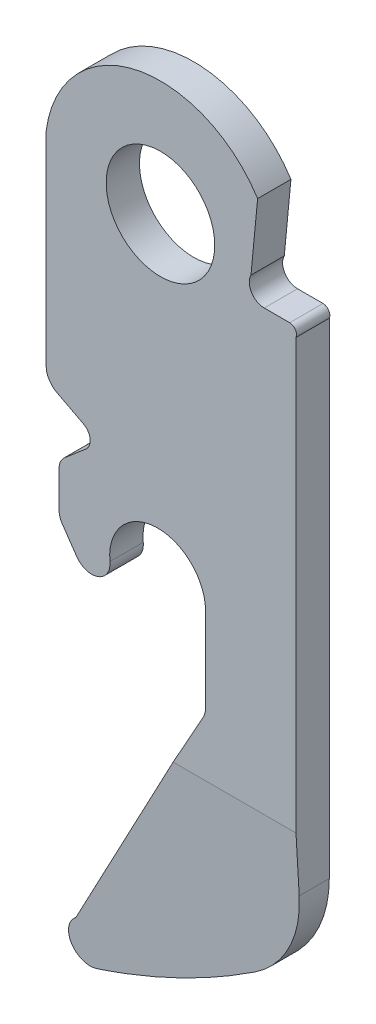
from build123d import *

# Parameters (mm, degrees)
BOSS_EXTRUDE1_DEPTH = 1.27
SKETCH2_R           = 2.0701
CUT_EXTRUDE1_DEPTH  = 96.894325048
FILLET1_R           = 0.762
CUT_EXTRUDE2_DEPTH  = 66.762647709


with BuildPart() as part:
    # Sketch1 → Boss-Extrude1 (new body)
    with BuildSketch(Plane.XY):
        with BuildLine():
            Line((70.418668008, 59.170892219), (70.418668008, 40.667063245))
            ThreePointArc((70.418668008, 40.667063245), (69.916079901, 38.650571737), (68.525894703, 37.105832949))
            ThreePointArc((68.525894703, 37.105832949), (65.524513786, 35.358150082), (62.318016547, 34.023587129))
            ThreePointArc((62.318016547, 34.023587129), (61.374370169, 34.399048489), (61.597136119, 35.389914297))
            Line((61.597136119, 35.389914297), (66.971326951, 45.020739493))
            Line((66.971326951, 45.020739493), (66.971326951, 45.081892935))
            Line((66.971326951, 45.081892935), (66.971326951, 48.411450821))
            ThreePointArc((66.971326951, 48.411450821), (65.049280342, 50.237036941), (63.324989299, 48.223619883))
            ThreePointArc((63.324989299, 48.223619883), (62.871910227, 47.497648894), (62.056667768, 47.757830092))
            Line((62.056667768, 47.757830092), (61.508546121, 48.557330489))
            ThreePointArc((61.508546121, 48.557330489), (61.415966978, 48.748623837), (61.38415702, 48.958748012))
            Line((61.38415702, 48.958748012), (61.38415702, 50.321868876))
            ThreePointArc((61.38415702, 50.321868876), (61.441635586, 50.582871835), (61.603436725, 50.795584602))
            Line((61.603436725, 50.795584602), (62.403550227, 51.474654267))
            ThreePointArc((62.403550227, 51.474654267), (62.569366717, 51.892616527), (62.315082966, 52.263463305))
            Line((62.315082966, 52.263463305), (60.893668008, 53.00414693))
            Line((60.893668008, 53.00414693), (60.893668008, 61.229242432))
            ThreePointArc((60.893668008, 61.229242432), (64.296000616, 64.951815231), (68.956183082, 63.02409253))
            Line((68.956183082, 63.02409253), (68.702842445, 60.369998915))
            ThreePointArc((68.702842445, 60.369998915), (68.721243039, 59.811306179), (69.208385593, 59.537137824))
            Line((69.208385593, 59.537137824), (70.180199819, 59.537137824))
            ThreePointArc((70.180199819, 59.537137824), (70.396787759, 59.417403618), (70.418668008, 59.170892219))
        make_face()
    extrude(amount=BOSS_EXTRUDE1_DEPTH)

    # Sketch2 → Cut-Extrude1 (cut, through all)
    with BuildSketch(Plane.XY.offset(1.27)):
        with Locations((65.250739592, 60.663101988)):
            Circle(SKETCH2_R)
    extrude(amount=-CUT_EXTRUDE1_DEPTH, mode=Mode.SUBTRACT)

    # Fillet1
    fillet1_edges = [part.edges().sort_by_distance(p)[0] for p in [
        (60.893668008, 53.00414693, 0.635),
        (66.971326951, 45.020739493, 0.635),
    ]]
    fillet(fillet1_edges, radius=FILLET1_R)

    # Sketch3 → Cut-Extrude2 (cut, through all)
    with BuildSketch(Plane(origin=(70.418668008, 0, 0), x_dir=(0, 0, -1), z_dir=(1, 0, 0))):
        Polygon((-1.27, 33.981904986), (-0.762, 33.981904986), (-1.27, 42.806738934), align=None)
    extrude(amount=-CUT_EXTRUDE2_DEPTH, mode=Mode.SUBTRACT)


solid = part.part
